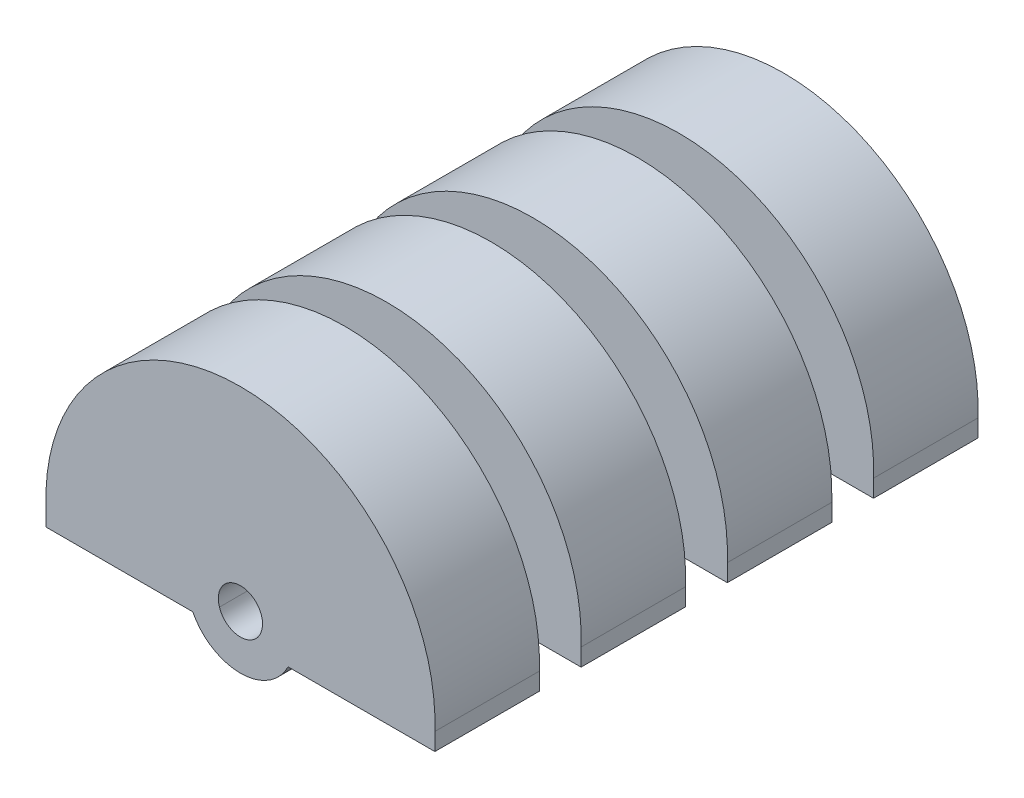
from build123d import *
from build123d.topology import SkipClean

# Parameters (mm, degrees)
SKETCH3_R            = 27.94
BOSS_EXTRUDE2_DEPTH  = 78
SKETCH5_R            = 3.175
CUT_EXTRUDE1_DEPTH   = 88.437332988
SKETCH4_W            = 14
SKETCH4_H            = 6
SHELL1_START         = 4.5
SHELL1_OUTLINE_R     = 23.44
SHELL1_OUTLINE_R_2   = 7.675
SHELL1_DEPTH         = 6
SHELL1_START_2       = 25.5
SHELL1_2_OUTLINE_R   = 23.44
SHELL1_2_OUTLINE_R_2 = 7.675
SHELL1_2_DEPTH       = 6
SHELL1_START_3       = 46.5
SHELL1_3_OUTLINE_R   = 23.44
SHELL1_3_OUTLINE_R_2 = 7.675
SHELL1_3_DEPTH       = 6
SHELL1_START_4       = 67.5
SHELL1_4_OUTLINE_R   = 23.44
SHELL1_4_OUTLINE_R_2 = 7.675
SHELL1_4_DEPTH       = 6
SHELL1_START_5       = 10.5
SHELL1_5_OUTLINE_R   = 9.44
SHELL1_5_OUTLINE_R_2 = 7.675
SHELL1_5_DEPTH       = 57
BOSS_EXTRUDE3_START  = -73.5
BOSS_EXTRUDE3_DEPTH  = 69
CUT_EXTRUDE3_DEPTH   = 78
BOSS_EXTRUDE5_DEPTH  = 78
SKETCH13_W           = 16.483162312
SKETCH13_H           = 6


# Read off the part's stored shape, not the designer's step: Shell1, Boss-Extrude3
with BuildPart() as part:
    # Sketch3 → Boss-Extrude2 (new body)
    with BuildSketch(Plane.XY):
        Circle(SKETCH3_R)
    extrude(amount=BOSS_EXTRUDE2_DEPTH)

    # Sketch5 → Cut-Extrude1 (cut, through all)
    with BuildSketch(Plane.XY.offset(78)):
        Circle(SKETCH5_R)
    extrude(amount=-CUT_EXTRUDE1_DEPTH, mode=Mode.SUBTRACT)

    # Sketch4 → Cut-Revolve1 (revolve, cut)
    with BuildSketch(Plane(origin=(0, 0, 0), x_dir=(1, 0, 0), z_dir=(0, 1, 0)), mode=Mode.PRIVATE) as cut_revolve1_sk:
        with Locations((-20.94, -60)):
            Rectangle(SKETCH4_W, SKETCH4_H)
        with Locations((-20.94, -39)):
            Rectangle(SKETCH4_W, SKETCH4_H)
        with Locations((-20.94, -18)):
            Rectangle(SKETCH4_W, SKETCH4_H)
    revolve(cut_revolve1_sk.sketch.rotate(Axis((0, 0, 78), (0, 0, -1)), 180), axis=Axis((0, 0, 78), (0, 0, -1)), mode=Mode.SUBTRACT)

    # Shell1 outline → Shell1 (cut)
    with BuildSketch(Plane.XY.offset(SHELL1_START)):
        Circle(SHELL1_OUTLINE_R)
        Circle(SHELL1_OUTLINE_R_2, mode=Mode.SUBTRACT)
    extrude(amount=SHELL1_DEPTH, mode=Mode.SUBTRACT)

    # Shell1 2 outline → Shell1 2 (cut)
    with BuildSketch(Plane.XY.offset(SHELL1_START_2)):
        Circle(SHELL1_2_OUTLINE_R)
        Circle(SHELL1_2_OUTLINE_R_2, mode=Mode.SUBTRACT)
    extrude(amount=SHELL1_2_DEPTH, mode=Mode.SUBTRACT)

    # Shell1 3 outline → Shell1 3 (cut)
    with BuildSketch(Plane.XY.offset(SHELL1_START_3)):
        Circle(SHELL1_3_OUTLINE_R)
        Circle(SHELL1_3_OUTLINE_R_2, mode=Mode.SUBTRACT)
    extrude(amount=SHELL1_3_DEPTH, mode=Mode.SUBTRACT)

    # Shell1 4 outline → Shell1 4 (cut)
    with BuildSketch(Plane.XY.offset(SHELL1_START_4)):
        Circle(SHELL1_4_OUTLINE_R)
        Circle(SHELL1_4_OUTLINE_R_2, mode=Mode.SUBTRACT)
    extrude(amount=SHELL1_4_DEPTH, mode=Mode.SUBTRACT)

    # Shell1 5 outline → Shell1 5 (cut)
    with BuildSketch(Plane.XY.offset(SHELL1_START_5)):
        Circle(SHELL1_5_OUTLINE_R)
        Circle(SHELL1_5_OUTLINE_R_2, mode=Mode.SUBTRACT)
    extrude(amount=SHELL1_5_DEPTH, mode=Mode.SUBTRACT)

    # Boss-Extrude3 outline → Boss-Extrude3 (add)
    with SkipClean():  # the faces are left unmerged after this step: merging them gives an invalid solid
        with BuildSketch(Plane(origin=(0, 0, 0), x_dir=(-1, 0, 0), z_dir=(0, 0, -1)).offset(BOSS_EXTRUDE3_START)):
            with BuildLine():
                ThreePointArc((27.922098775, -1), (27.94, 0), (27.922098775, 1))
                Line((27.922098775, 1), (7.609574561, 1))
                ThreePointArc((7.609574561, 1), (7.675, 0), (7.609574561, -1))
                Line((7.609574561, -1), (27.922098775, -1))
            make_face()
            with BuildLine():
                ThreePointArc((1, 27.922098775), (0, 27.94), (-1, 27.922098775))
                Line((-1, 27.922098775), (-1, 7.609574561))
                ThreePointArc((-1, 7.609574561), (0, 7.675), (1, 7.609574561))
                Line((1, 7.609574561), (1, 27.922098775))
            make_face()
            with BuildLine():
                ThreePointArc((-1, -27.922098775), (0, -27.94), (1, -27.922098775))
                Line((1, -27.922098775), (1, -7.609574561))
                ThreePointArc((1, -7.609574561), (0, -7.675), (-1, -7.609574561))
                Line((-1, -7.609574561), (-1, -27.922098775))
            make_face()
            with BuildLine():
                ThreePointArc((-27.922098775, 1), (-27.94, 0), (-27.922098775, -1))
                Line((-27.922098775, -1), (-7.609574561, -1))
                ThreePointArc((-7.609574561, -1), (-7.675, 0), (-7.609574561, 1))
                Line((-7.609574561, 1), (-27.922098775, 1))
            make_face()
        extrude(amount=BOSS_EXTRUDE3_DEPTH)

    # Sketch16 → Cut-Extrude3 (cut)
    with SkipClean():  # the faces are left unmerged after this step: merging them gives an invalid solid
        with BuildSketch(Plane(origin=(0, 0, 0), x_dir=(-1, 0, 0), z_dir=(0, 0, -1))):
            with BuildLine():
                Line((-3.01340754, -1), (-27.922098775, -1))
                ThreePointArc((-27.922098775, -1), (0, -27.94), (27.922098775, -1))
                Line((27.922098775, -1), (3.01340754, -1))
                ThreePointArc((3.01340754, -1), (0, -3.175), (-3.01340754, -1))
            make_face()
        extrude(amount=-CUT_EXTRUDE3_DEPTH, mode=Mode.SUBTRACT)

    # Sketch18 → Boss-Extrude5 (add)
    with SkipClean():  # the faces are left unmerged after this step: merging them gives an invalid solid
        with BuildSketch(Plane(origin=(0, 0, 0), x_dir=(-1, 0, 0), z_dir=(0, 0, -1))):
            with BuildLine():
                Line((-3.01340754, -1), (-27.922098775, -1))
                Line((-27.922098775, -1), (-27.922098775, -3.5))
                Line((-27.922098775, -3.5), (-6.840431771, -3.5))
                ThreePointArc((-6.840431771, -3.5), (0.000223346, -7.717020739), (6.840632422, -3.49960091))
                Line((6.840632422, -3.49960091), (27.886307794, -3.499359298))
                Line((27.886307794, -3.499359298), (27.922098775, -1))
                Line((27.922098775, -1), (3.01340754, -1))
                ThreePointArc((3.01340754, -1), (0, -3.217020742), (-3.01340754, -1))
            make_face()
        extrude(amount=-BOSS_EXTRUDE5_DEPTH)

    # Sketch13 → Cut-Revolve2 (revolve, cut)
    with BuildSketch(Plane(origin=(0, 0, 0), x_dir=(1, 0, 0), z_dir=(0, 1, 0))):
        with Locations((-22.145666886, -39)):
            Rectangle(SKETCH13_W, SKETCH13_H)
        with Locations((-22.145666886, -18)):
            Rectangle(SKETCH13_W, SKETCH13_H)
        with Locations((-22.145666886, -60)):
            Rectangle(SKETCH13_W, SKETCH13_H)
    revolve(axis=Axis((0, 0, 77.128746248), (0, 0, -1)), mode=Mode.SUBTRACT)


solid = part.part
